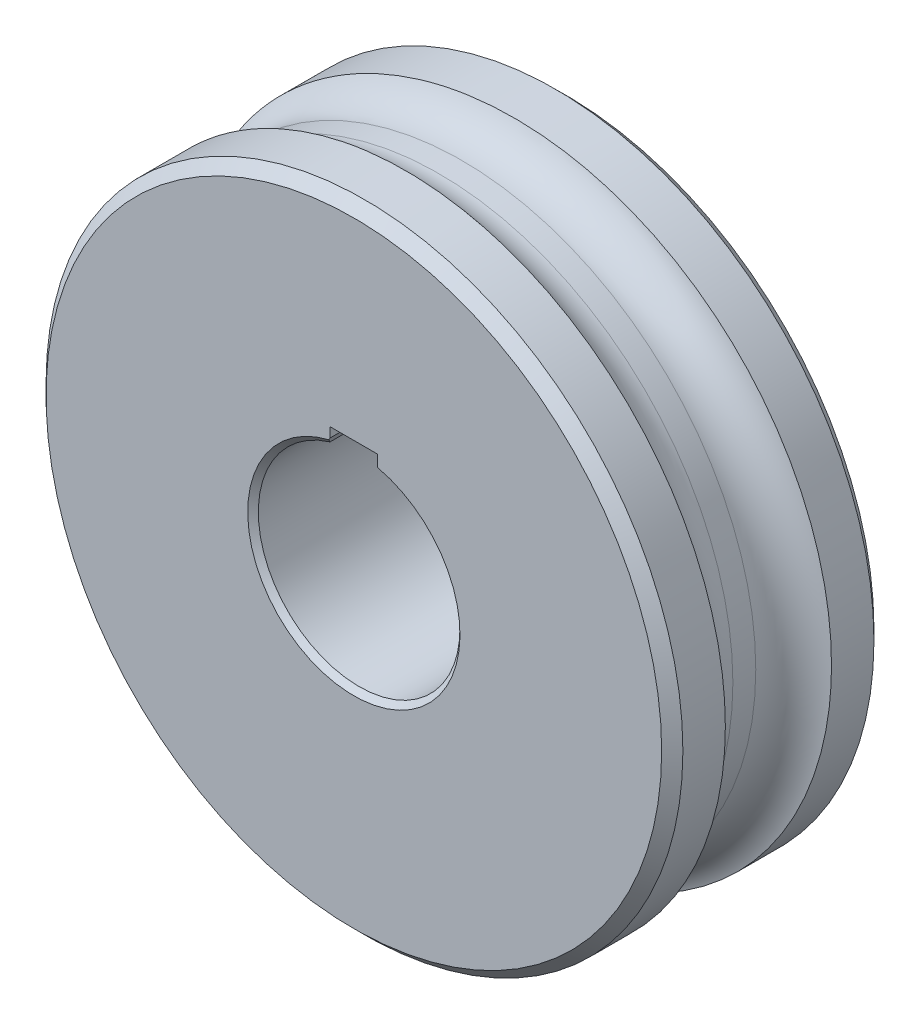
from build123d import *

# Parameters (mm, degrees)
SKETCH_1_R               = 60
SKETCH_1_R_2             = 14.438127561
EXTRUDE_1_DEPTH          = 40
CHAMFER_1_SIZE           = 2
SKETCH_5_R               = 25.161734689
EXTRUDE_2_DEPTH          = 40
CUT_EXTRUDE_1_DEPTH      = 776.044855896
CUT_EXTRUDE_1_DEPTH_BACK = 776.044855896
CHAMFER_2_SIZE           = 1.361088561
CHAMFER_2_SIZE_2         = 1


with BuildPart() as part:
    # 草图1 → 凸台-拉伸1 (new body)
    with BuildSketch(Plane.XY.offset(70.26)):
        with Locations((-297.670899951, 626.415366791)):
            Circle(SKETCH_1_R)
        with Locations((-297.670899951, 626.415366791)):
            Circle(SKETCH_1_R_2, mode=Mode.SUBTRACT)
    extrude(amount=-EXTRUDE_1_DEPTH)

    # 草图4 → 切除-旋转1 (revolve, cut)
    with BuildSketch(Plane(origin=(0, 626.415366791, 0), x_dir=(1, 0, 0), z_dir=(0, 1, 0))):
        with BuildLine():
            Line((-244.095308656, -48.103310059), (-244.095308655, -52.416689982))
            ThreePointArc((-244.095308655, -52.416689982), (-242.284199059, -57.48597347), (-237.670899813, -60.259999987))
            Line((-237.670899813, -60.259999987), (-237.670899811, -40.260000013))
            ThreePointArc((-237.670899811, -40.260000013), (-242.284199071, -43.034026546), (-244.095308656, -48.103310059))
        make_face()
    revolve(axis=Axis((-299.491656028, 626.415366791, 70.26), (0, 0, -1)), mode=Mode.SUBTRACT)

    # 倒角1
    chamfer_1_edges = [part.edges().sort_by_distance(p)[0] for p in [
        (-357.670899951, 626.415366791, 70.26),
        (-357.670899951, 626.415366791, 30.26),
    ]]
    chamfer(chamfer_1_edges, length=CHAMFER_1_SIZE)

    # 草图5 → 凸台-拉伸2 (add)
    with BuildSketch(Plane.XY.offset(70.26)):
        with Locations((-297.670899951, 626.415366791)):
            Circle(SKETCH_5_R)
    extrude(amount=-EXTRUDE_2_DEPTH)

    # 草图6 → 切除-拉伸1 (cut, two sides: drawn at the far end of the back side and taken through both)
    with BuildSketch(Plane(origin=(0, 0, 30.26), x_dir=(-1, 0, 0), z_dir=(0, 0, -1)).offset(-CUT_EXTRUDE_1_DEPTH_BACK)):
        with BuildLine():
            ThreePointArc((302.170899951, 644.874781733), (297.670899951, 645.415366791), (293.170899951, 644.874781733))
            Line((293.170899951, 644.874781733), (293.170899951, 626.415366791))
            Line((293.170899951, 626.415366791), (302.170899951, 626.415366791))
            Line((302.170899951, 626.415366791), (302.170899951, 644.874781733))
        make_face()
        with BuildLine():
            Line((293.170899951, 626.415366791), (293.170899951, 644.874781733))
            ThreePointArc((293.170899951, 644.874781733), (285.934205356, 611.473813993), (316.670899951, 626.415366791))
            ThreePointArc((316.670899951, 626.415366791), (312.612452748, 638.152061385), (302.170899951, 644.874781733))
            Line((302.170899951, 644.874781733), (302.170899951, 626.415366791))
            Line((302.170899951, 626.415366791), (293.170899951, 626.415366791))
        make_face()
        with BuildLine():
            Line((302.170899951, 648.095366791), (293.170899951, 648.095366791))
            Line((293.170899951, 648.095366791), (293.170899951, 644.874781733))
            ThreePointArc((293.170899951, 644.874781733), (297.670899951, 645.415366791), (302.170899951, 644.874781733))
            Line((302.170899951, 644.874781733), (302.170899951, 648.095366791))
        make_face()
    extrude(amount=CUT_EXTRUDE_1_DEPTH + CUT_EXTRUDE_1_DEPTH_BACK, mode=Mode.SUBTRACT)

    # 倒角2
    # the kernel refuses this chamfer: 1.361088561, 1 mm, written as the material it takes off along each edge
    with BuildSketch(Plane(origin=(-302.170899951, 644.874781733, 26.740268541), x_dir=(0, 1, 0), z_dir=(0, 0, 1))) as chamfer_2_piece_1:
        with BuildLine():
            Line((CHAMFER_2_SIZE, 0), (-0.270460462, 0.991988248))
            ThreePointArc((-0.270460462, 0.991988248), (-0.133734106, 0.516913582), (0, 0))
            Line((0, 0), (CHAMFER_2_SIZE, 0))
        make_face()
    extrude(amount=47.039462917, mode=Mode.SUBTRACT)
    with BuildSketch(Plane(origin=(-293.170899951, 644.874781733, 26.506479775), x_dir=(0, 1, 0), z_dir=(0, 0, 1))) as chamfer_2_piece_2:
        with BuildLine():
            Line((CHAMFER_2_SIZE_2, 0), (-0.398045781, -1.398045781))
            ThreePointArc((-0.398045781, -1.398045781), (-0.192184694, -0.725734308), (0, 0))
            Line((0, 0), (CHAMFER_2_SIZE_2, 0))
        make_face()
    extrude(amount=47.507040451, mode=Mode.SUBTRACT)
    # the kernel refuses this chamfer: 1.361088561, 1 mm, written as the material it takes off along each edge
    with BuildSketch(Plane(origin=(-297.670899951, 626.415366791, 30.26), x_dir=(0.17889175862136222, 0.9838687609114116, 0), z_dir=(-0.9838687609114116, 0.17889175862136222, 0))) as chamfer_2_2_piece_1:
        Polygon((19, -CHAMFER_2_SIZE_2), (19 + CHAMFER_2_SIZE_2, 0), (19, 0), align=None)
    revolve(axis=Axis((-297.670899951, 626.415366791, 30.26), (0, 0, -1)), revolution_arc=259.694785461, mode=Mode.SUBTRACT)
    with BuildSketch(Plane(origin=(-297.670899951, 626.415366791, 70.26), x_dir=(0.17889175862137457, 0.9838687609114093, 0), z_dir=(-0.9838687609114093, 0.17889175862137457, 0))) as chamfer_2_2_piece_2:
        Polygon((19 + CHAMFER_2_SIZE_2, 0), (19, CHAMFER_2_SIZE_2), (19, 0), align=None)
    revolve(axis=Axis((-297.670899951, 626.415366791, 70.26), (0, 0, -1)), revolution_arc=259.694785461, mode=Mode.SUBTRACT)
    with BuildSketch(Plane(origin=(-297.670899951, 626.415366791, 70.26), x_dir=(-1, 0, 0), z_dir=(0, -1, 0))) as chamfer_2_2_piece_3:
        Polygon((19 + CHAMFER_2_SIZE_2, 0), (19, CHAMFER_2_SIZE_2), (19, 0), align=None)
    revolve(axis=Axis((-297.670899951, 626.415366791, 70.26), (0, 0, -1)), revolution_arc=80.955933819, mode=Mode.SUBTRACT)
    with BuildSketch(Plane(origin=(-297.670899951, 626.415366791, 30.26), x_dir=(-1, 0, 0), z_dir=(0, -1, 0))) as chamfer_2_2_piece_4:
        Polygon((19, -CHAMFER_2_SIZE_2), (19 + CHAMFER_2_SIZE_2, 0), (19, 0), align=None)
    revolve(axis=Axis((-297.670899951, 626.415366791, 30.26), (0, 0, -1)), revolution_arc=80.955933819, mode=Mode.SUBTRACT)


solid = part.part
